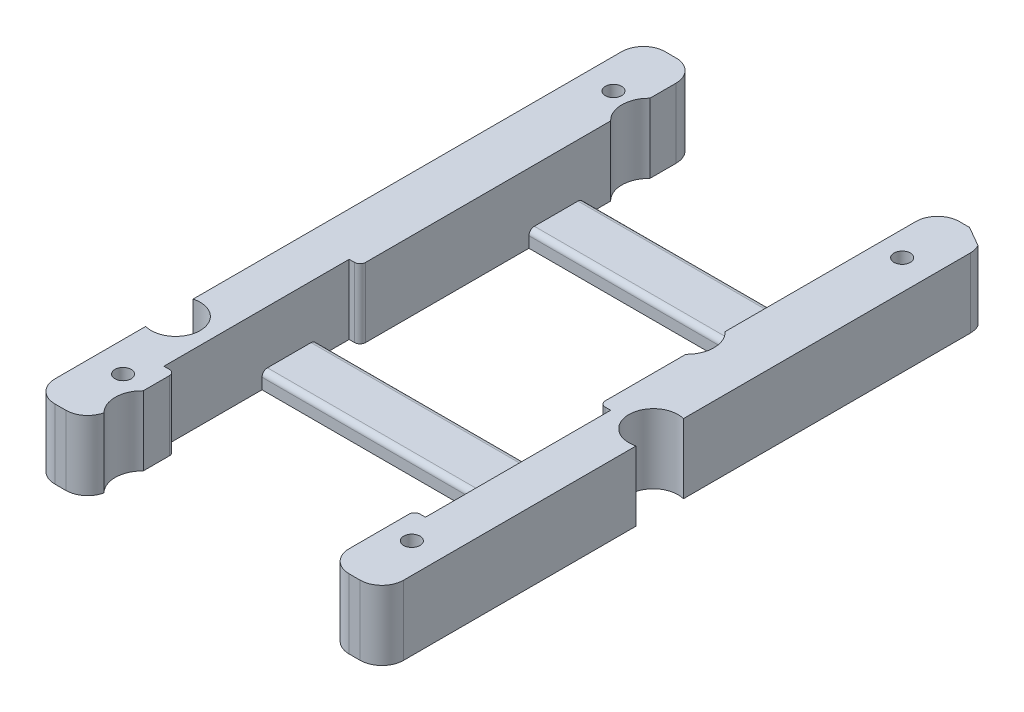
from build123d import *

# Parameters (mm, degrees)
SKETCH1_W             = 10
SKETCH1_H             = 112
BOSS_EXTRUDE1_DEPTH   = 12.75
BOSS_EXTRUDE1_2_DEPTH = 12.75
FILLET1_R             = 4
FILLET2_R             = 4
SKETCH2_R             = 1.5
SKETCH2_R_2           = 3
CUT_EXTRUDE1_DEPTH    = 118.177482905
SKETCH3_W             = 48
SKETCH3_H             = 34
CUT_EXTRUDE2_DEPTH    = 12.75
SKETCH4_R             = 5
SKETCH4_R_2           = 4.5
CUT_EXTRUDE3_DEPTH    = 118.177482905
BOSS_EXTRUDE2_REACH   = 126.99
SKETCH5_W             = 10
SKETCH5_H             = 3
BOSS_EXTRUDE3_REACH   = 127.867
SKETCH6_W             = 10
SKETCH6_H             = 3
FILLET3_R             = 1


with BuildPart() as part:
    # Sketch1 → Boss-Extrude1 (new body)
    with BuildSketch(Plane(origin=(0, 0, 0), x_dir=(1, 0, 0), z_dir=(0, 1, 0))):
        with Locations((-27, 56)):
            Rectangle(SKETCH1_W, SKETCH1_H)
    extrude(amount=BOSS_EXTRUDE1_DEPTH)

    # Fillet2
    fillet2_edges = [part.edges().sort_by_distance(p)[0] for p in [
        (-22, 6.375, 0),
        (-32, 6.375, 0),
        (-32, 6.375, -112),
        (-22, 6.375, -112),
    ]]
    fillet(fillet2_edges, radius=FILLET2_R)


with BuildPart() as body_2:
    # Sketch1 → Boss-Extrude1 2 (new body)
    with BuildSketch(Plane(origin=(0, 0, 0), x_dir=(1, 0, 0), z_dir=(0, 1, 0))):
        with Locations((27, 56)):
            Rectangle(SKETCH1_W, SKETCH1_H)
    extrude(amount=BOSS_EXTRUDE1_2_DEPTH)

    # Fillet1
    fillet1_edges = [body_2.edges().sort_by_distance(p)[0] for p in [
        (32, 6.375, 0),
        (22, 6.375, 0),
        (32, 6.375, -112),
        (22, 6.375, -112),
    ]]
    fillet(fillet1_edges, radius=FILLET1_R)


with BuildPart() as cut_extrude1_tool:
    # Sketch2 → Cut-Extrude1 (new, through all)
    with BuildSketch(Plane(origin=(0, 12.75, 0), x_dir=(1, 0, 0), z_dir=(0, 1, 0))):
        with Locations((-26.5, 101)):
            Circle(SKETCH2_R)
        with Locations((26.5, 101)):
            Circle(SKETCH2_R)
        with Locations((26.5, 11)):
            Circle(SKETCH2_R)
        with Locations((-26.5, 11)):
            Circle(SKETCH2_R)
        with Locations((0, 38)):
            Circle(SKETCH2_R_2)
    extrude(amount=-CUT_EXTRUDE1_DEPTH)


with BuildPart() as part_1:
    add(part.part)

    # Cut-Extrude1: cut by cut_extrude1_tool
    add(cut_extrude1_tool.part, mode=Mode.SUBTRACT)


with BuildPart() as body_2_1:
    add(body_2.part)

    # Cut-Extrude1: cut by cut_extrude1_tool
    add(cut_extrude1_tool.part, mode=Mode.SUBTRACT)


with BuildPart() as cut_extrude2_tool:
    # Sketch3 → Cut-Extrude2 (new body)
    with BuildSketch(Plane(origin=(0, 12.75, 0), x_dir=(1, 0, 0), z_dir=(0, 1, 0))):
        with Locations((0, 33)):
            Rectangle(SKETCH3_W, SKETCH3_H)
    extrude(amount=-CUT_EXTRUDE2_DEPTH)


with BuildPart() as part_2:
    add(part_1.part)

    # Cut-Extrude2: cut by cut_extrude2_tool
    add(cut_extrude2_tool.part, mode=Mode.SUBTRACT)


with BuildPart() as body_2_2:
    add(body_2_1.part)

    # Cut-Extrude2: cut by cut_extrude2_tool
    add(cut_extrude2_tool.part, mode=Mode.SUBTRACT)


with BuildPart() as cut_extrude3_tool:
    # Sketch4 → Cut-Extrude3 (new, through all)
    with BuildSketch(Plane.XZ):
        with Locations((18.538884711, -69.4)):
            Circle(SKETCH4_R)
        with Locations((-18.538884711, -99.6)):
            Circle(SKETCH4_R)
        with Locations((-18.538884711, -6.6)):
            Circle(SKETCH4_R)
        with Locations((30.838884711, -51)):
            Circle(SKETCH4_R_2)
        with Locations((-30.838884711, -25)):
            Circle(SKETCH4_R_2)
        with BuildLine():
            ThreePointArc((31.774007787, -109.75), (30.281326332, -111.686308388), (27.856664361, -112))
            add(Edge.make_bspline(
                [(31.774007787, -109.75), (30.468226645, -110.5), (29.162445503, -111.25), (27.856664361, -112)],
                knots=[0, 0, 0, 0, 1, 1, 1, 1], degree=3))
        make_face()
    extrude(amount=-CUT_EXTRUDE3_DEPTH)


with BuildPart() as part_3:
    add(part_2.part)

    # Cut-Extrude3: cut by cut_extrude3_tool
    add(cut_extrude3_tool.part, mode=Mode.SUBTRACT)


with BuildPart() as body_2_3:
    add(body_2_2.part)

    # Cut-Extrude3: cut by cut_extrude3_tool
    add(cut_extrude3_tool.part, mode=Mode.SUBTRACT)

    # Sketch5 → Boss-Extrude2 (add, up to next)
    with BuildSketch(Plane(origin=(-22, 0, 0), x_dir=(0, 0, -1), z_dir=(1, 0, 0)), mode=Mode.PRIVATE) as boss_extrude2_sk1:
        with Locations((85.991581932, 1.5)):
            Rectangle(SKETCH5_W, SKETCH5_H)
    boss_extrude2_tool1 = extrude(boss_extrude2_sk1.sketch, amount=BOSS_EXTRUDE2_REACH, mode=Mode.PRIVATE) - body_2_3.part

    add(part_3.part)  # Boss-Extrude2 merges part
    add(boss_extrude2_tool1.solids().sort_by_distance((-22, 1.5, -85.991582))[0])

    # Sketch6 → Boss-Extrude3 (add, up to next)
    with BuildSketch(Plane(origin=(-24, 0, 0), x_dir=(0, 0, -1), z_dir=(1, 0, 0)), mode=Mode.PRIVATE) as boss_extrude3_sk1:
        with Locations((39, 1.5)):
            Rectangle(SKETCH6_W, SKETCH6_H)
    boss_extrude3_tool1 = extrude(boss_extrude3_sk1.sketch, amount=BOSS_EXTRUDE3_REACH, mode=Mode.PRIVATE) - body_2_3.part
    add(boss_extrude3_tool1.solids().sort_by_distance((-24, 1.5, -39))[0])

    # Fillet3
    fillet3_edges = [body_2_3.edges().sort_by_distance(p)[0] for p in [
        (0, 3, -90.991581932),
        (0, 3, -80.991581932),
        (0, 3, -44),
        (0, 3, -34),
        (22, 6.375, -50),
        (22, 6.375, -16),
        (-22, 6.375, -50),
        (-22, 6.375, -16),
    ]]
    fillet(fillet3_edges, radius=FILLET3_R)


solid = body_2_3.part
